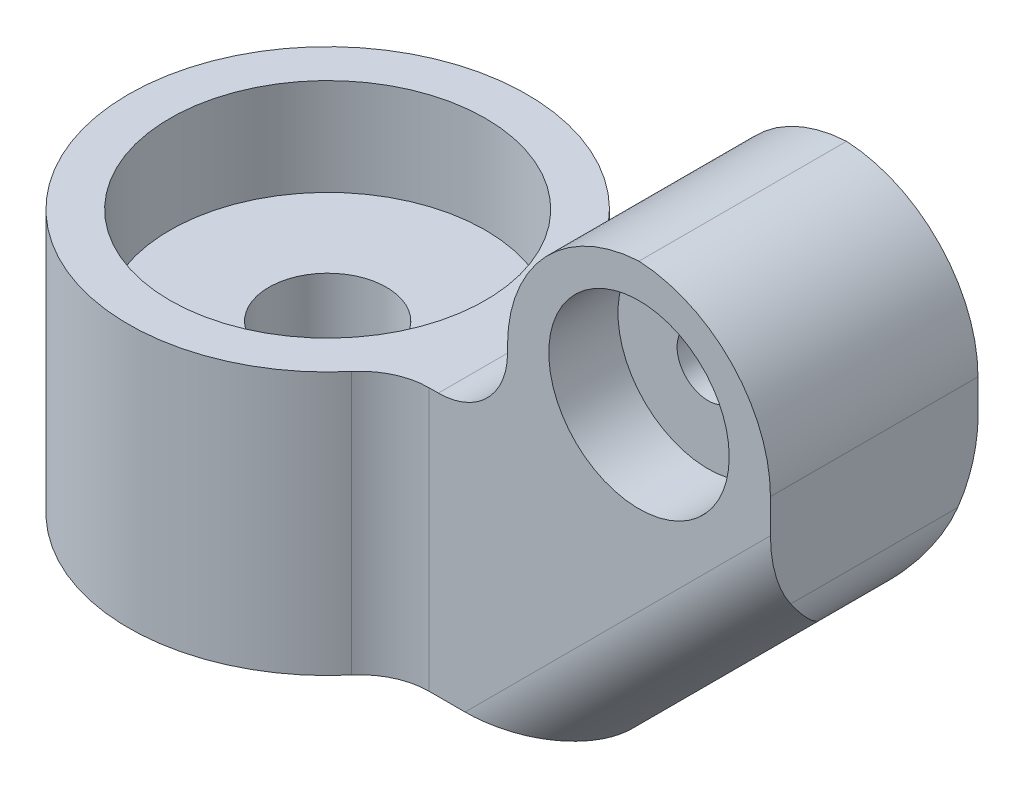
from build123d import *

# Parameters (mm, degrees)
SKETCH1_R               = 2.25
BOSS_EXTRUDE1_DEPTH     = 7.5
CUT_EXTRUDE1_START      = 7.5
SKETCH1_3_R             = 6.52
CUT_EXTRUDE1_DEPTH      = 5
CUT_EXTRUDE2_START      = -7.5
SKETCH1_4_R             = 6.52
CUT_EXTRUDE2_DEPTH      = 5
SKETCH2_R               = 14.4
BOSS_EXTRUDE2_DEPTH     = 19
CUT_EXTRUDE3_DEPTH      = 51.395634732
CUT_EXTRUDE3_DEPTH_BACK = 51.395634732
CUT_EXTRUDE4_DEPTH      = 7
CUT_EXTRUDE5_START      = -12
SKETCH2_5_R             = 11.4
CUT_EXTRUDE5_DEPTH      = 7
FILLET1_R               = 5
FILLET2_R               = 10
FILLET3_R               = 5


with BuildPart() as part:
    # Sketch1 → Boss-Extrude1 (new, symmetric)
    with BuildSketch(Plane.XY):
        Polygon((-9.5, 9), (9.5, 9), (9.5, -10.52), (-5.5, -25.52), (-30, -25.52), (-30, -6.52), (-9.5, -6.52), align=None)
        Circle(SKETCH1_R, mode=Mode.SUBTRACT)
    extrude(amount=BOSS_EXTRUDE1_DEPTH, both=True)

    # Sketch1<3> → Cut-Extrude1 (cut)
    with BuildSketch(Plane.XY.offset(CUT_EXTRUDE1_START)):
        Circle(SKETCH1_3_R)
    extrude(amount=-CUT_EXTRUDE1_DEPTH, mode=Mode.SUBTRACT)

    # Sketch1<4> → Cut-Extrude2 (cut)
    with BuildSketch(Plane.XY.offset(CUT_EXTRUDE2_START)):
        Circle(SKETCH1_4_R)
    extrude(amount=CUT_EXTRUDE2_DEPTH, mode=Mode.SUBTRACT)

    # Sketch2 → Boss-Extrude2 (add, through all)
    with BuildSketch(Plane(origin=(0, -6.52, 0), x_dir=(1, 0, 0), z_dir=(0, 1, 0))):
        with Locations((-30, 0)):
            Circle(SKETCH2_R)
    extrude(amount=-BOSS_EXTRUDE2_DEPTH)

    # Sketch2<3> → Cut-Extrude3 (cut, two sides: drawn at the far end of the back side and taken through both)
    with BuildSketch(Plane(origin=(0, -6.52, 0), x_dir=(1, 0, 0), z_dir=(0, 1, 0)).offset(-CUT_EXTRUDE3_DEPTH_BACK)):
        with BuildLine():
            ThreePointArc((-30, -4.25), (-26.99479618, -3.00520382), (-25.75, 0))
            ThreePointArc((-25.75, 0), (-26.99479618, 3.00520382), (-30, 4.25))
            Line((-30, 4.25), (-30, -4.25))
        make_face()
        with BuildLine():
            Line((-30, -4.25), (-30, 4.25))
            ThreePointArc((-30, 4.25), (-34.25, 0), (-30, -4.25))
        make_face()
    extrude(amount=CUT_EXTRUDE3_DEPTH + CUT_EXTRUDE3_DEPTH_BACK, mode=Mode.SUBTRACT)

    # Sketch2<4> → Cut-Extrude4 (cut)
    with BuildSketch(Plane(origin=(0, -6.52, 0), x_dir=(1, 0, 0), z_dir=(0, 1, 0))):
        with BuildLine():
            ThreePointArc((-21.414547187, -7.5), (-19.326805491, -4.005361278), (-18.6, 0))
            ThreePointArc((-18.6, 0), (-19.326805491, 4.005361278), (-21.414547187, 7.5))
            Line((-21.414547187, 7.5), (-30, 7.5))
            Line((-30, 7.5), (-30, 4.25))
            ThreePointArc((-30, 4.25), (-26.99479618, 3.00520382), (-25.75, 0))
            ThreePointArc((-25.75, 0), (-26.99479618, -3.00520382), (-30, -4.25))
            Line((-30, -4.25), (-30, -7.5))
            Line((-30, -7.5), (-21.414547187, -7.5))
        make_face()
        with BuildLine():
            Line((-30, 7.5), (-21.414547187, 7.5))
            ThreePointArc((-21.414547187, 7.5), (-41.4, 0), (-21.414547187, -7.5))
            Line((-21.414547187, -7.5), (-30, -7.5))
            Line((-30, -7.5), (-30, -4.25))
            ThreePointArc((-30, -4.25), (-34.25, 0), (-30, 4.25))
            Line((-30, 4.25), (-30, 7.5))
        make_face()
    extrude(amount=-CUT_EXTRUDE4_DEPTH, mode=Mode.SUBTRACT)

    # Sketch2<5> → Cut-Extrude5 (cut)
    with BuildSketch(Plane(origin=(0, -6.52, 0), x_dir=(1, 0, 0), z_dir=(0, 1, 0)).offset(CUT_EXTRUDE5_START)):
        with Locations(Location((-30, 0, 0), (0, 0, 270))):
            Circle(SKETCH2_5_R)
    extrude(amount=-CUT_EXTRUDE5_DEPTH, mode=Mode.SUBTRACT)

    # Fillet1
    fillet1_edges = [part.edges().sort_by_distance(p)[0] for p in [
        (-9.5, -6.52, 0),
        (-17.707319251, -16.02, -7.5),
        (-17.707319251, -16.02, 7.5),
    ]]
    fillet(fillet1_edges, radius=FILLET1_R)

    # Fillet2
    # the kernel refuses this fillet: 10 mm, written as the material it takes off along each edge
    with BuildSketch(Plane(origin=(-9.5, 9, -32.5), x_dir=(0, -1, 0), z_dir=(0, 0, 1))) as fillet2_piece_1:
        with BuildLine():
            CenterArc((FILLET2_R, FILLET2_R), FILLET2_R, 180, 90)
            Line((0, FILLET2_R), (0, 0))
            Line((0, 0), (FILLET2_R, 0))
        make_face()
    extrude(amount=65, mode=Mode.SUBTRACT)
    with BuildSketch(Plane(origin=(9.5, 9, 32.5), x_dir=(-1, 0, 0), z_dir=(0, 0, -1))) as fillet2_piece_2:
        with BuildLine():
            CenterArc((FILLET2_R, -FILLET2_R), FILLET2_R, 90, 90)
            Line((0, -FILLET2_R), (0, 0))
            Line((0, 0), (FILLET2_R, 0))
        make_face()
    extrude(amount=65, mode=Mode.SUBTRACT)

    # Fillet3
    fillet3_edges = [part.edges().sort_by_distance(p)[0] for p in [
        (2, -18.02, -7.5),
        (9.5, -10.52, 0),
        (2, -18.02, 7.5),
    ]]
    fillet(fillet3_edges, radius=FILLET3_R)


solid = part.part
